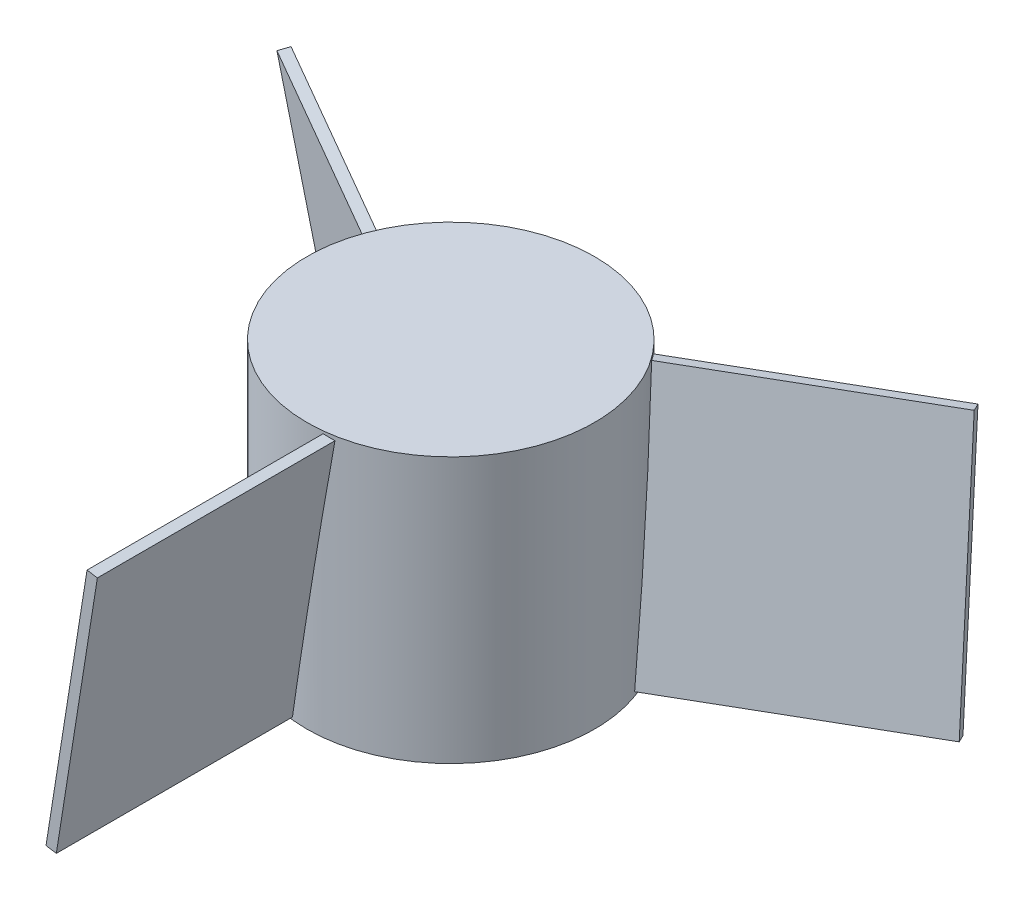
from build123d import *

# Parameters (mm, degrees)
SKETCH1_R           = 82.5
BOSS_EXTRUDE1_DEPTH = 152.4
SKETCH3_W           = 217.5
SKETCH3_H           = 150.523703107
BOSS_EXTRUDE2_DEPTH = 3
CIRPATTERN1_COUNT   = 3


with BuildPart() as part:
    # Sketch1 → Boss-Extrude1 (new body)
    with BuildSketch(Plane(origin=(0, 0, 0), x_dir=(1, 0, 0), z_dir=(0, 1, 0))):
        Circle(SKETCH1_R)
    extrude(amount=BOSS_EXTRUDE1_DEPTH)

    # Sketch3 → Boss-Extrude2 (add, symmetric)
    with BuildSketch(Plane(origin=(-11.773547486, 1.864746729, 0), x_dir=(0, 0, -1), z_dir=(0.9876883405951377, -0.1564344650402312, 0))):
        with Locations((-108.75, 75.261851554)):
            Rectangle(SKETCH3_W, SKETCH3_H)
    boss_extrude2 = extrude(amount=BOSS_EXTRUDE2_DEPTH, both=True)

    # CirPattern1: Boss-Extrude2 ×3 about axis
    cirpattern1_axis = Axis((0, 152.4, 0), (0, -1, 0))
    for i in range(1, CIRPATTERN1_COUNT):
        add(boss_extrude2.rotate(cirpattern1_axis, i * 360 / CIRPATTERN1_COUNT))


solid = part.part
